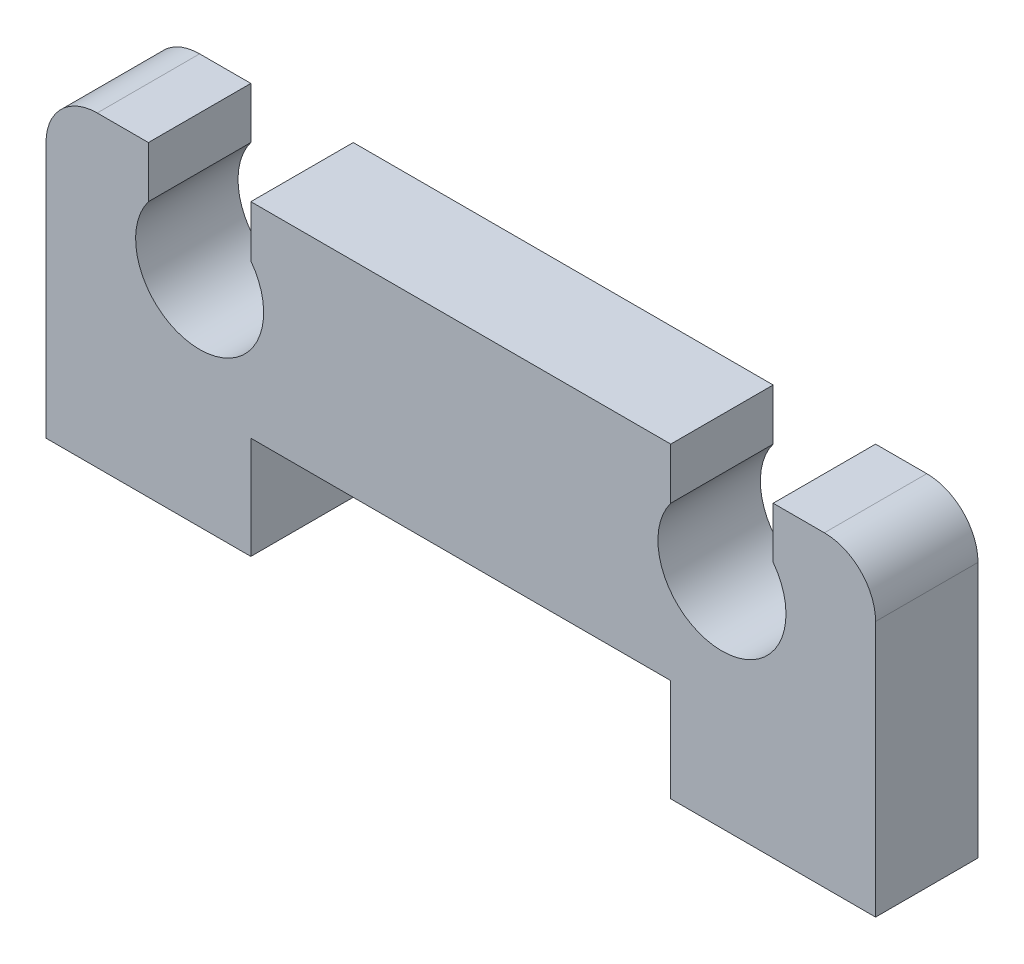
from build123d import *

# Parameters (mm, degrees)
BOSS_EXTRUDE1_DEPTH = 2


with BuildPart() as part:
    # Sketch1 → Boss-Extrude1 (new body)
    with BuildSketch(Plane.XY):
        with BuildLine():
            Line((12.2, 2), (12.2, 0))
            Line((12.2, 0), (16.2, 0))
            Line((16.2, 0), (16.2, 5))
            ThreePointArc((16.2, 5), (15.907106781, 5.707106781), (15.2, 6))
            Line((15.2, 6), (14.2, 6))
            Line((14.2, 6), (14.2, 5))
            ThreePointArc((14.2, 5), (13.2, 3), (12.2, 5))
            Line((12.2, 5), (12.2, 6))
            Line((12.2, 6), (4, 6))
            Line((4, 6), (4, 5))
            ThreePointArc((4, 5), (3, 3), (2, 5))
            Line((2, 5), (2, 6))
            Line((2, 6), (1, 6))
            ThreePointArc((1, 6), (0.292893219, 5.707106781), (0, 5))
            Line((0, 5), (0, 0))
            Line((0, 0), (4, 0))
            Line((4, 0), (4, 2))
            Line((4, 2), (12.2, 2))
        make_face()
    extrude(amount=BOSS_EXTRUDE1_DEPTH)


solid = part.part
